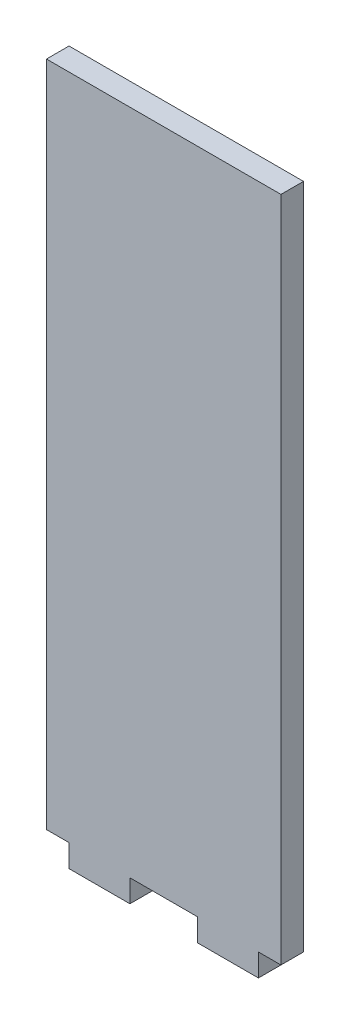
from build123d import *

# Parameters (mm, degrees)
BOSS_EXTRUDE1_DEPTH = 6.35


with BuildPart() as part:
    # Sketch2 → Boss-Extrude1 (new body)
    with BuildSketch(Plane.XY):
        Polygon((26.67, -100.33), (26.67, -93.98), (33.02, -93.98), (33.02, 93.98), (-33.02, 93.98), (-33.02, -93.98), (-26.67, -93.98), (-26.67, -100.33), (-9.525, -100.33), (-9.525, -93.98), (9.525, -93.98), (9.525, -100.33), align=None)
    extrude(amount=BOSS_EXTRUDE1_DEPTH)


solid = part.part
